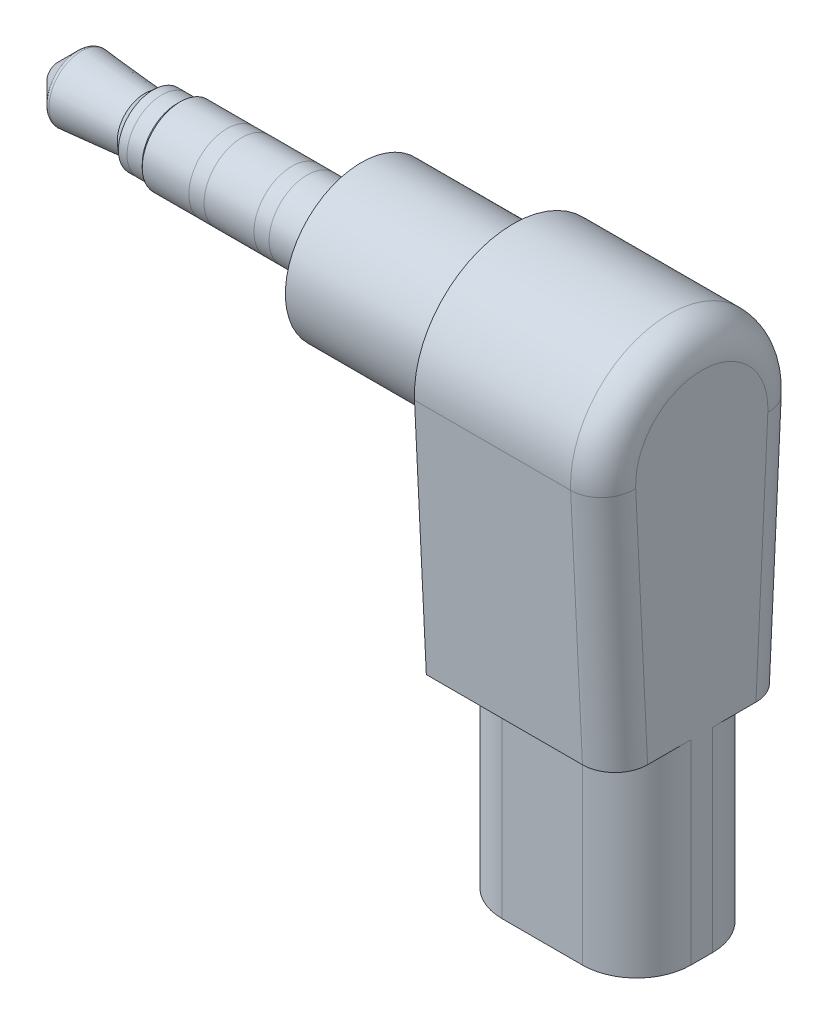
from build123d import *

# Parameters (mm, degrees)
SKETCH1_R           = 3.5
BOSS_EXTRUDE1_DEPTH = 7
BOSS_EXTRUDE2_DEPTH = 8.7
FILLET1_R           = 2.5
FILLET2_R           = 1.5


with BuildPart() as part:
    # SurfaceCut1: read off the stored shape, not the designer's step
    # SurfaceCut1 outline → SurfaceCut1 (revolve)
    with BuildSketch(Plane.YX):
        with BuildLine():
            Line((0.5, 0), (1.434408923, 0.934408923))
            ThreePointArc((1.434408923, 0.934408923), (1.4807846, 1.007038752), (1.492296719, 1.092439376))
            Line((1.492296719, 1.092439376), (1.25, 4))
            Line((1.25, 4), (1.6, 4.4))
            Line((1.6, 4.4), (1.6, 5.5))
            Line((1.6, 5.5), (1.75, 5.65))
            Line((1.75, 5.65), (1.75, 14))
            Line((1.75, 14), (0, 14))
            Line((0, 14), (0, 0))
            Line((0, 0), (0.5, 0))
        make_face()
    revolve(axis=Axis((0, 0, 0), (1, 0, 0)))

    # Sketch1 → Boss-Extrude1 (add)
    with BuildSketch(Plane(origin=(14, 0, 0), x_dir=(0, 0, -1), z_dir=(1, 0, 0))):
        Circle(SKETCH1_R)
    extrude(amount=BOSS_EXTRUDE1_DEPTH)

    # Sketch2 → Boss-Extrude2 (add)
    with BuildSketch(Plane(origin=(21, 0, 0), x_dir=(0, 0, -1), z_dir=(1, 0, 0))):
        with BuildLine():
            Line((-4, -11.45), (-4.544657599, -0.220425293))
            ThreePointArc((-4.544657599, -0.220425293), (0, 4.55), (4.544657599, -0.220425293))
            Line((4.544657599, -0.220425293), (4, -11.45))
            Line((4, -11.45), (3, -11.45))
            Line((3, -11.45), (3, -20.45))
            Line((3, -20.45), (-3, -20.45))
            Line((-3, -20.45), (-3, -11.45))
            Line((-3, -11.45), (-4, -11.45))
        make_face()
    extrude(amount=BOSS_EXTRUDE2_DEPTH)

    # Fillet1
    fillet1_edges = [part.edges().sort_by_distance(p)[0] for p in [
        (21, -15.95, 3),
        (21, -15.95, -3),
        (29.7, -15.95, 3),
        (29.7, -15.95, -3),
    ]]
    fillet(fillet1_edges, radius=FILLET1_R)

    # Fillet2
    fillet2_edges = [part.edges().sort_by_distance(p)[0] for p in [
        (29.7, 4.55, 0),
        (29.7, -5.835212647, 4.272328799),
        (29.7, -5.835212647, -4.272328799),
    ]]
    fillet(fillet2_edges, radius=FILLET2_R)


solid = part.part
